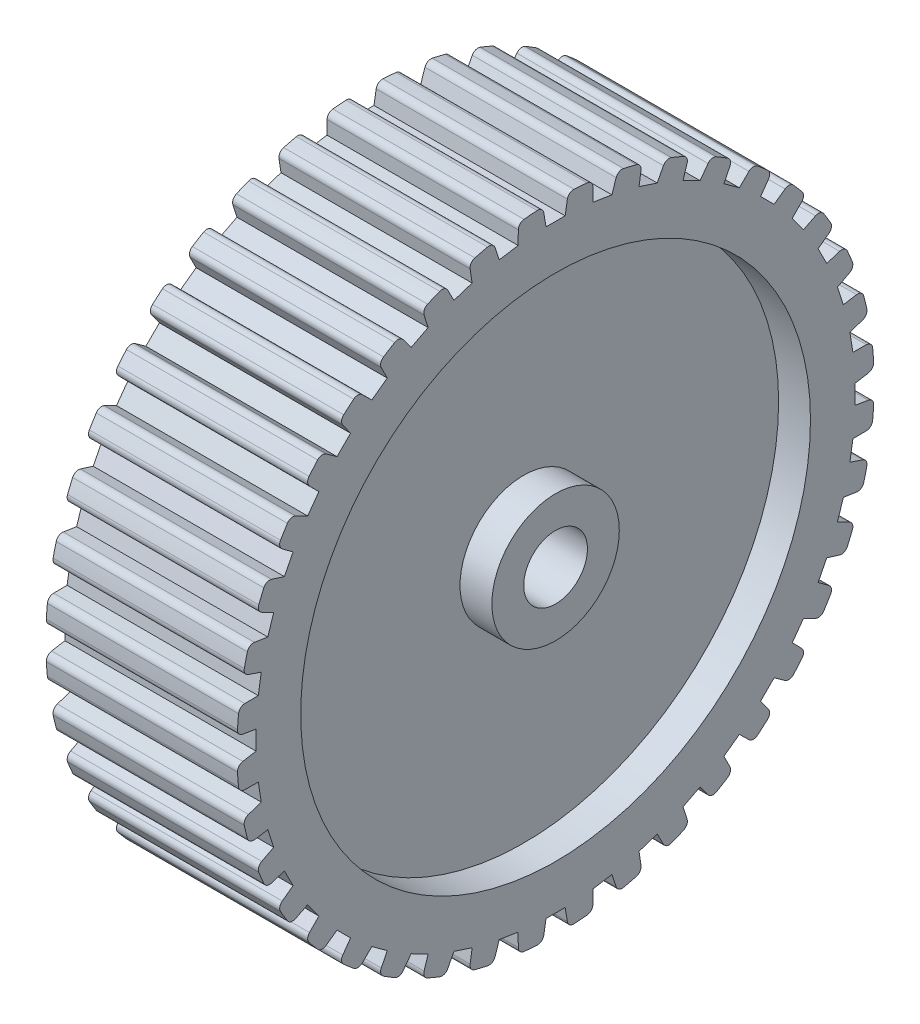
from build123d import *

# Parameters (mm, degrees)
CUT_EXTRUDE1_DEPTH       = 44
FILLET1_R                = 1
CIRPATTERN1_COUNT        = 40
FILLET1_OF_CIRPATTERN1_R = 1
SCALE1_SCALE             = 0.5


with BuildPart() as part:
    # Sketch1 → Revolve1 (revolve)
    with BuildSketch(Plane.XY):
        Polygon((0, 5), (-30, 5), (-30, 10), (-25, 10), (-25, 40), (-30, 40), (-30, 50), (0, 50), (0, 40), (-5, 40), (-5, 10), (0, 10), align=None)
    revolve(axis=Axis((0, 0, 0), (-1, 0, 0)))

    # Sketch2 → Cut-Extrude1 (cut)
    with BuildSketch(Plane(origin=(0, 0, 0), x_dir=(0, 0, -1), z_dir=(1, 0, 0))):
        Polygon((-2.5, 53), (-1.5, 47), (1.5, 47), (2.5, 53), align=None)
    cut_extrude1 = extrude(amount=-CUT_EXTRUDE1_DEPTH, mode=Mode.SUBTRACT)

    # Fillet1
    fillet1_edges = [part.edges().sort_by_distance(p)[0] for p in [
        (-15, 49.960248768, 1.993374795),
        (-15, 49.960248768, -1.993374795),
    ]]
    fillet(fillet1_edges, radius=FILLET1_R)

    # CirPattern1: Cut-Extrude1 ×40 about axis
    cirpattern1_axis = Axis((0, 0, 0), (1, 0, 0))
    for i in range(1, CIRPATTERN1_COUNT):
        add(cut_extrude1.rotate(cirpattern1_axis, i * 360 / CIRPATTERN1_COUNT), mode=Mode.SUBTRACT)

    # Fillet1 of CirPattern1
    fillet1_of_cirpattern1_edges = [part.edges().sort_by_distance(p)[0] for p in [
        (-15, 49.033322681, 9.784337832),
        (-15, 49.656987721, 5.846671746),
        (-15, 46.899033459, 17.334378),
        (-15, 48.131006834, 13.542753825),
        (-15, 43.609934383, 24.457588252),
        (-15, 45.419880821, 20.905368358),
        (-15, 39.24701399, 30.978571512),
        (-15, 41.590366603, 27.753223342),
        (-15, 33.917701859, 36.736759528),
        (-15, 36.736759528, 33.917701859),
        (-15, 27.753223342, 41.590366603),
        (-15, 30.978571512, 39.24701399),
        (-15, 20.905368358, 45.419880821),
        (-15, 24.457588252, 43.609934383),
        (-15, 13.542753825, 48.131006834),
        (-15, 17.334378, 46.899033459),
        (-15, 5.846671746, 49.656987721),
        (-15, 9.784337832, 49.033322681),
        (-15, -1.993374795, 49.960248768),
        (-15, 1.993374795, 49.960248768),
        (-15, -9.784337832, 49.033322681),
        (-15, -5.846671746, 49.656987721),
        (-15, -17.334378, 46.899033459),
        (-15, -13.542753825, 48.131006834),
        (-15, -24.457588252, 43.609934383),
        (-15, -20.905368358, 45.419880821),
        (-15, -30.978571512, 39.24701399),
        (-15, -27.753223342, 41.590366603),
        (-15, -36.736759528, 33.917701859),
        (-15, -33.917701859, 36.736759528),
        (-15, -41.590366603, 27.753223342),
        (-15, -39.24701399, 30.978571512),
        (-15, -45.419880821, 20.905368358),
        (-15, -43.609934383, 24.457588252),
        (-15, -48.131006834, 13.542753825),
        (-15, -46.899033459, 17.334378),
        (-15, -49.656987721, 5.846671746),
        (-15, -49.033322681, 9.784337832),
        (-15, -49.960248768, -1.993374795),
        (-15, -49.960248768, 1.993374795),
        (-15, -49.033322681, -9.784337832),
        (-15, -49.656987721, -5.846671746),
        (-15, -46.899033459, -17.334378),
        (-15, -48.131006834, -13.542753825),
        (-15, -43.609934383, -24.457588252),
        (-15, -45.419880821, -20.905368358),
        (-15, -39.24701399, -30.978571512),
        (-15, -41.590366603, -27.753223342),
        (-15, -33.917701859, -36.736759528),
        (-15, -36.736759528, -33.917701859),
        (-15, -27.753223342, -41.590366603),
        (-15, -30.978571512, -39.24701399),
        (-15, -20.905368358, -45.419880821),
        (-15, -24.457588252, -43.609934383),
        (-15, -13.542753825, -48.131006834),
        (-15, -17.334378, -46.899033459),
        (-15, -5.846671746, -49.656987721),
        (-15, -9.784337832, -49.033322681),
        (-15, 1.993374795, -49.960248768),
        (-15, -1.993374795, -49.960248768),
        (-15, 9.784337832, -49.033322681),
        (-15, 5.846671746, -49.656987721),
        (-15, 17.334378, -46.899033459),
        (-15, 13.542753825, -48.131006834),
        (-15, 24.457588252, -43.609934383),
        (-15, 20.905368358, -45.419880821),
        (-15, 30.978571512, -39.24701399),
        (-15, 27.753223342, -41.590366603),
        (-15, 36.736759528, -33.917701859),
        (-15, 33.917701859, -36.736759528),
        (-15, 41.590366603, -27.753223342),
        (-15, 39.24701399, -30.978571512),
        (-15, 45.419880821, -20.905368358),
        (-15, 43.609934383, -24.457588252),
        (-15, 48.131006834, -13.542753825),
        (-15, 46.899033459, -17.334378),
        (-15, 49.656987721, -5.846671746),
        (-15, 49.033322681, -9.784337832),
    ]]
    fillet(fillet1_of_cirpattern1_edges, radius=FILLET1_OF_CIRPATTERN1_R)


with BuildPart() as part_1:
    # Scale1: scaled about (-15, 0, 0)
    add(part.part.scale(SCALE1_SCALE).moved(Location((-7.5, 0, 0))))


solid = part_1.part
